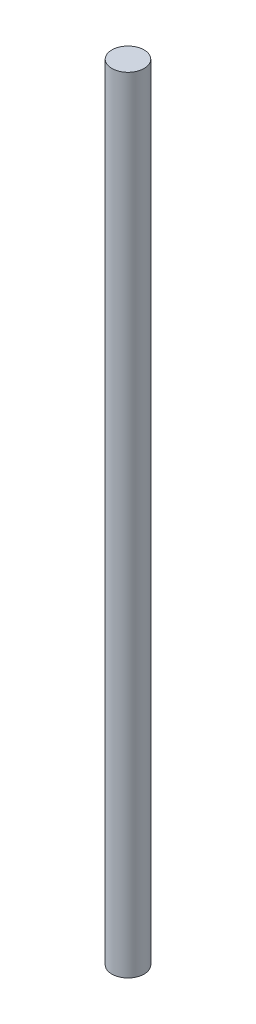
from build123d import *

# Parameters (mm, degrees)
SZKIC1_R                    = 1.5
DODANIE_WYCI_GNI_CIE1_DEPTH = 73


with BuildPart() as part:
    # Szkic1 → Dodanie-wyciągnięcie1 (new body)
    with BuildSketch(Plane(origin=(0, 0, 0), x_dir=(1, 0, 0), z_dir=(0, 1, 0))):
        Circle(SZKIC1_R)
    extrude(amount=DODANIE_WYCI_GNI_CIE1_DEPTH)


solid = part.part
